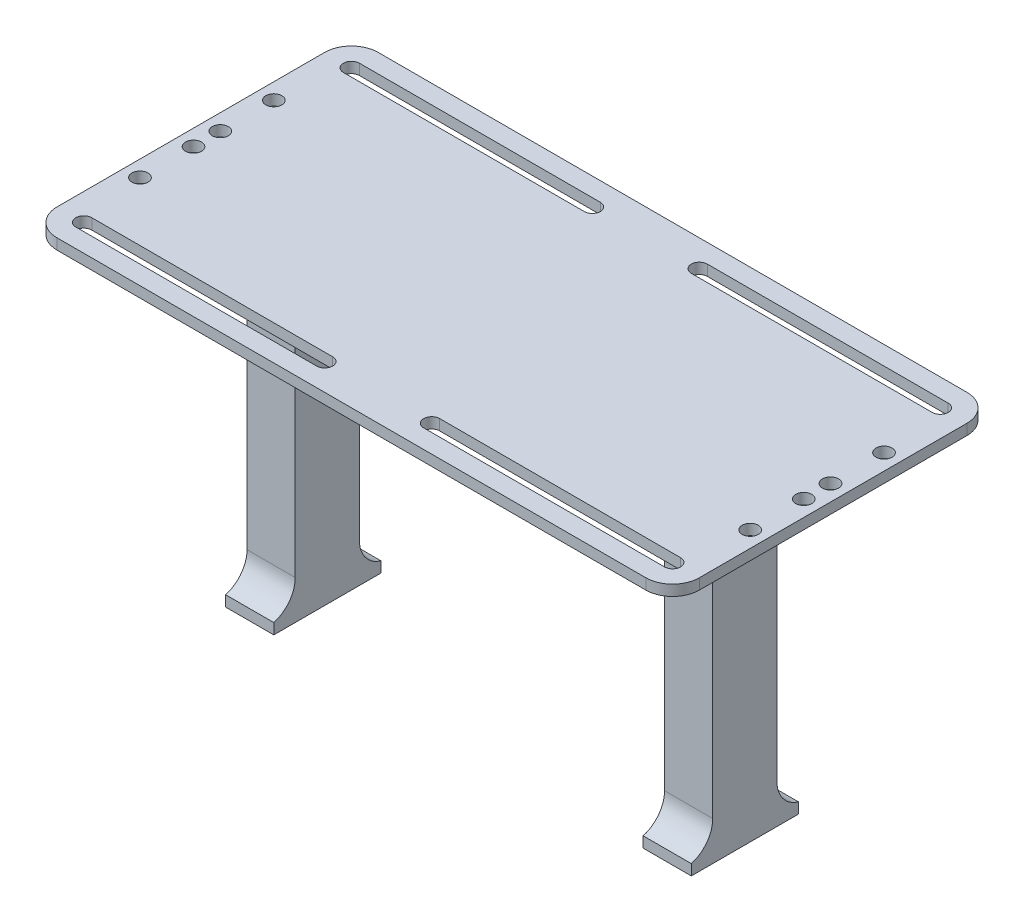
from build123d import *

# Parameters (mm, degrees)
SKETCH1_W             = 9
SKETCH1_H             = 12
BOSS_EXTRUDE1_DEPTH   = 60
BOSS_EXTRUDE1_2_DEPTH = 60
SKETCH2_W             = 9
SKETCH2_H             = 20
BOSS_EXTRUDE2_DEPTH   = 2
SKETCH3_R             = 1.4
CUT_EXTRUDE1_DEPTH    = 6
FILLET1_R             = 5.5
FILLET2_R             = 5.5
SKETCH4_R             = 1.5
BOSS_EXTRUDE4_DEPTH   = 2
FILLET4_R             = 10


with BuildPart() as part:
    # Sketch1 → Boss-Extrude1 (new body)
    with BuildSketch(Plane(origin=(0, 0, 0), x_dir=(1, 0, 0), z_dir=(0, 1, 0))):
        with Locations((39, 0)):
            Rectangle(SKETCH1_W, SKETCH1_H)
    extrude(amount=BOSS_EXTRUDE1_DEPTH)



with BuildPart() as body_2:
    # Sketch1 → Boss-Extrude1 2 (new body)
    with BuildSketch(Plane(origin=(0, 0, 0), x_dir=(1, 0, 0), z_dir=(0, 1, 0))):
        with Locations((-39, 0)):
            Rectangle(SKETCH1_W, SKETCH1_H)
    extrude(amount=BOSS_EXTRUDE1_2_DEPTH)


with BuildPart() as part_1:
    add(part.part)

    add(body_2.part)  # Boss-Extrude2 merges body 2
    # Sketch2 → Boss-Extrude2 (add)
    with BuildSketch(Plane.XZ):
        with Locations((-39, 0)):
            Rectangle(SKETCH2_W, SKETCH2_H)
        with Locations((39, 0)):
            Rectangle(SKETCH2_W, SKETCH2_H)
    extrude(amount=BOSS_EXTRUDE2_DEPTH)

    # Sketch3 → Cut-Extrude1 (cut)
    with BuildSketch(Plane.XZ.offset(2)):
        with Locations(Location((39, 0, 0), (0, 0, 270))):
            Circle(SKETCH3_R)
        with Locations(Location((-39, 0, 0), (0, 0, 270))):
            Circle(SKETCH3_R)
    extrude(amount=-CUT_EXTRUDE1_DEPTH, mode=Mode.SUBTRACT)

    # Fillet1
    # the kernel refuses this fillet: 5.5 mm, written as the material it adds along each edge
    with BuildSketch(Plane(origin=(-43.5, 0, -6), x_dir=(0, 1, 0), z_dir=(1, 0, 0))) as fillet1_piece_1:
        with BuildLine():
            CenterArc((5.291502622, -5.5), FILLET1_R, 90, 74.173379868)
            Line((0, -4), (-0.105830052, -3.97))
            ThreePointArc((-0.105830052, -3.97), (-0.11, -2), (-0.11, 0))
            Line((-0.11, 0), (0, 0.11))
            Line((0, 0.11), (5.291502622, 0.11))
            Line((5.291502622, 0.11), (5.291502622, 0))
        make_face()
    extrude(amount=9)
    with BuildSketch(Plane(origin=(-34.5, 0, 6), x_dir=(0, 0, 1), z_dir=(-1, 0, 0))) as fillet1_piece_2:
        with BuildLine():
            CenterArc((5.5, 5.291502622), FILLET1_R, 180, 74.173379868)
            Line((0, 5.291502622), (-0.11, 5.291502622))
            Line((-0.11, 5.291502622), (-0.11, 0))
            Line((-0.11, 0), (0, -0.11))
            ThreePointArc((0, -0.11), (2, -0.11), (3.97, -0.105830052))
            Line((3.97, -0.105830052), (4, 0))
        make_face()
    extrude(amount=9)

    # Fillet2
    # the kernel refuses this fillet: 5.5 mm, written as the material it adds along each edge
    with BuildSketch(Plane(origin=(34.5, 0, -6), x_dir=(0, 0, -1), z_dir=(1, 0, 0))) as fillet2_piece_1:
        with BuildLine():
            CenterArc((5.5, 5.291502622), FILLET2_R, 180, 74.173379868)
            Line((0, 5.291502622), (-0.11, 5.291502622))
            Line((-0.11, 5.291502622), (-0.11, 0))
            Line((-0.11, 0), (0, -0.11))
            ThreePointArc((0, -0.11), (2, -0.11), (3.97, -0.105830052))
            Line((3.97, -0.105830052), (4, 0))
        make_face()
    extrude(amount=9)
    with BuildSketch(Plane(origin=(43.5, 0, 6), x_dir=(0, 1, 0), z_dir=(-1, 0, 0))) as fillet2_piece_2:
        with BuildLine():
            CenterArc((5.291502622, -5.5), FILLET2_R, 90, 74.173379868)
            Line((0, -4), (-0.105830052, -3.97))
            ThreePointArc((-0.105830052, -3.97), (-0.11, -2), (-0.11, 0))
            Line((-0.11, 0), (0, 0.11))
            Line((0, 0.11), (5.291502622, 0.11))
            Line((5.291502622, 0.11), (5.291502622, 0))
        make_face()
    extrude(amount=9)

    # Sketch4 → Boss-Extrude4 (add)
    with BuildSketch(Plane(origin=(0, 60, 0), x_dir=(1, 0, 0), z_dir=(0, 1, 0))):
        with BuildLine():
            Line((-55, 30), (55, 30))
            ThreePointArc((55, 30), (58.535533906, 28.535533906), (60, 25))
            Line((60, 25), (60, -25))
            ThreePointArc((60, -25), (58.535533906, -28.535533906), (55, -30))
            Line((55, -30), (-55, -30))
            ThreePointArc((-55, -30), (-58.535533906, -28.535533906), (-60, -25))
            Line((-60, -25), (-60, 25))
            ThreePointArc((-60, 25), (-58.535533906, 28.535533906), (-55, 30))
        make_face()
        with Locations(Location((-57, -2.5, 0), (0, 0, 270))):
            Circle(SKETCH4_R, mode=Mode.SUBTRACT)
        with Locations(Location((-57, -12.5, 0), (0, 0, 270))):
            Circle(SKETCH4_R, mode=Mode.SUBTRACT)
        with Locations(Location((57, -12.5, 0), (0, 0, 270))):
            Circle(SKETCH4_R, mode=Mode.SUBTRACT)
        with Locations(Location((57, -2.5, 0), (0, 0, 270))):
            Circle(SKETCH4_R, mode=Mode.SUBTRACT)
        with Locations(Location((57, 2.5, 0), (0, 0, 270))):
            Circle(SKETCH4_R, mode=Mode.SUBTRACT)
        with Locations(Location((57, 12.5, 0), (0, 0, 270))):
            Circle(SKETCH4_R, mode=Mode.SUBTRACT)
        with Locations(Location((-57, 12.5, 0), (0, 0, 270))):
            Circle(SKETCH4_R, mode=Mode.SUBTRACT)
        with Locations(Location((-57, 2.5, 0), (0, 0, 270))):
            Circle(SKETCH4_R, mode=Mode.SUBTRACT)
        with BuildLine():
            Line((55, 23.5), (10, 23.5))
            ThreePointArc((10, 23.5), (8.5, 25), (10, 26.5))
            Line((10, 26.5), (55, 26.5))
            ThreePointArc((55, 26.5), (56.5, 25), (55, 23.5))
        make_face(mode=Mode.SUBTRACT)
        with BuildLine():
            Line((-55, -23.5), (-10, -23.5))
            ThreePointArc((-10, -23.5), (-8.5, -25), (-10, -26.5))
            Line((-10, -26.5), (-55, -26.5))
            ThreePointArc((-55, -26.5), (-56.5, -25), (-55, -23.5))
        make_face(mode=Mode.SUBTRACT)
        with BuildLine():
            Line((-55, 23.5), (-10, 23.5))
            ThreePointArc((-10, 23.5), (-8.5, 25), (-10, 26.5))
            Line((-10, 26.5), (-55, 26.5))
            ThreePointArc((-55, 26.5), (-56.5, 25), (-55, 23.5))
        make_face(mode=Mode.SUBTRACT)
        with BuildLine():
            Line((55, -23.5), (10, -23.5))
            ThreePointArc((10, -23.5), (8.5, -25), (10, -26.5))
            Line((10, -26.5), (55, -26.5))
            ThreePointArc((55, -26.5), (56.5, -25), (55, -23.5))
        make_face(mode=Mode.SUBTRACT)
    extrude(amount=BOSS_EXTRUDE4_DEPTH)

    # Fillet4
    fillet4_edges = [part_1.edges().sort_by_distance(p)[0] for p in [
        (39, 60, 6),
        (39, 60, -6),
        (-39, 60, -6),
        (-39, 60, 6),
    ]]
    fillet(fillet4_edges, radius=FILLET4_R)


solid = part_1.part
